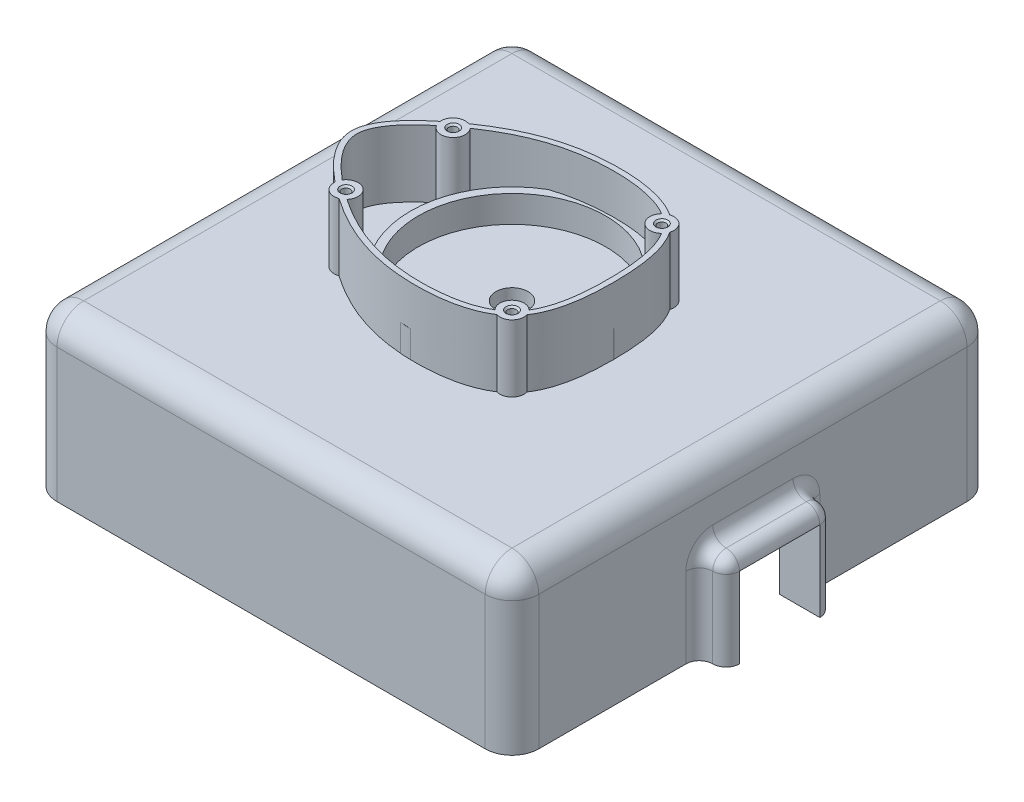
from build123d import *

# Parameters (mm, degrees)
SKETCH1_W                              = 180
SKETCH1_H                              = 180
SKETCH1_R                              = 6
BOSS_EXTRUDE1_DEPTH                    = 60
SHELL1_T                               = -5
FILLET1_R                              = 10
FILLET2_R                              = 10
FILLET3_R                              = 10
SKETCH3_W                              = 20
SKETCH3_H                              = 5
CUT_EXTRUDE2_DEPTH                     = 7
BOSS_EXTRUDE2_DEPTH                    = 10
FILLET4_R                              = 5
BOSS_EXTRUDE3_DEPTH                    = 25
BOSS_EXTRUDE4_OUTLINE_R                = 35
BOSS_EXTRUDE4_DEPTH                    = 10
F_1_8_0_125_DIAMETER_HOLE1_D           = 3.175
F_1_8_0_125_DIAMETER_HOLE1_CSINK_D     = 4.445
F_1_8_0_125_DIAMETER_HOLE1_CSINK_ANGLE = 90


# Read off the part's stored shape, not the designer's step: Boss-Extrude3, Boss-Extrude4
with BuildPart() as part:
    # Sketch1 → Boss-Extrude1 (new body)
    with BuildSketch(Plane(origin=(0, 0, 0), x_dir=(1, 0, 0), z_dir=(0, 1, 0))):
        Rectangle(SKETCH1_W, SKETCH1_H)
        with Locations(Location((0, 0, 0), (0, 0, 270))):
            Circle(SKETCH1_R, mode=Mode.SUBTRACT)
    extrude(amount=BOSS_EXTRUDE1_DEPTH)

    # Shell1
    shell1_openings = [part.faces().sort_by_distance(p)[0] for p in [
        (0, 0, -87.454415588),
        (0, 30, -6),
    ]]
    offset(amount=SHELL1_T, openings=shell1_openings, kind=Kind.INTERSECTION)

    # Fillet1
    fillet1_edges = [part.edges().sort_by_distance(p)[0] for p in [
        (-85, 27.5, -85),
        (-85, 27.5, 85),
        (85, 27.5, 85),
        (85, 27.5, -85),
        (-90, 30, -90),
        (90, 30, -90),
        (90, 30, 90),
        (-90, 30, 90),
    ]]
    fillet(fillet1_edges, radius=FILLET1_R)

    # Fillet2
    fillet2_edges = [part.edges().sort_by_distance(p)[0] for p in [
        (0, 55, -85),
        (-85, 55, 0),
        (85, 55, 0),
        (0, 55, 85),
        (82.071067812, 55, 82.071067812),
        (82.071067812, 55, -82.071067812),
        (-82.071067812, 55, 82.071067812),
        (-82.071067812, 55, -82.071067812),
    ]]
    fillet(fillet2_edges, radius=FILLET2_R)

    # Fillet3
    fillet3_edges = [part.edges().sort_by_distance(p)[0] for p in [
        (-90, 60, 0),
        (0, 60, -90),
        (0, 60, 90),
        (90, 60, 0),
        (87.071067812, 60, -87.071067812),
        (87.071067812, 60, 87.071067812),
        (-87.071067812, 60, 87.071067812),
        (-87.071067812, 60, -87.071067812),
    ]]
    fillet(fillet3_edges, radius=FILLET3_R)

    # Sketch3 → Cut-Extrude2 (cut)
    with BuildSketch(Plane(origin=(90, 0, 0), x_dir=(0, 0, -1), z_dir=(1, 0, 0))):
        Polygon((-15, 0), (-10, 0), (-10, 5), (10, 5), (10, 0), (15, 0), (15, 30), (-15, 30), align=None)
        with Locations((0, 2.5)):
            Rectangle(SKETCH3_W, SKETCH3_H)
    extrude(amount=-CUT_EXTRUDE2_DEPTH, mode=Mode.SUBTRACT)

    # Sketch3<3> → Boss-Extrude2 (add)
    with BuildSketch(Plane(origin=(90, 0, 0), x_dir=(0, 0, -1), z_dir=(1, 0, 0))):
        Polygon((-20, 0), (-15, 0), (-15, 30), (15, 30), (15, 0), (20, 0), (20, 35), (-20, 35), align=None)
    extrude(amount=BOSS_EXTRUDE2_DEPTH)

    # Fillet4
    fillet4_edges = [part.edges().sort_by_distance(p)[0] for p in [
        (100, 17.5, -20),
        (100, 35, 0),
        (95, 35, -20),
        (100, 17.5, 20),
        (95, 35, 20),
        (90, 17.5, -20),
        (90, 17.5, 20),
        (90, 35, 0),
    ]]
    fillet(fillet4_edges, radius=FILLET4_R - 0.0001)  # a hair under: the kernel refuses the full size

    # Boss-Extrude3 outline → Boss-Extrude3 (add)
    with BuildSketch(Plane(origin=(0, 60, 0), x_dir=(1, 0, 0), z_dir=(0, 1, 0))):
        with BuildLine():
            add(Edge.make_bspline(
                [(26.625087679, -32.284812261), (19.606901749, -36.911394991), (-7.262514584, -40.404404335), (-27.710750447, -33.072321099), (-40.409877501, -24.20969244)],
                knots=[0.629826975, 0.629826975, 0.629826975, 0.629826975, 0.72774654, 0.885945732, 0.885945732, 0.885945732, 0.885945732], degree=3))
            ThreePointArc((26.625087679, -32.284812261), (31.152069654, -31.211612819), (32.309789146, -26.705504917))
            add(Edge.make_bspline(
                [(32.297215607, 26.664358571), (36.884317589, 19.814857456), (39.082762224, -0.044680784), (36.950417692, -19.872519787), (32.309789146, -26.705504917)],
                knots=[0.402262299, 0.402262299, 0.402262299, 0.402262299, 0.499984825, 0.598070041, 0.598070041, 0.598070041, 0.598070041], degree=3))
            ThreePointArc((32.297215607, 26.664358571), (31.175671551, 31.188276996), (26.647345626, 32.291890742))
            add(Edge.make_bspline(
                [(-40.409671434, 24.209614596), (-27.70735639, 33.064564243), (-7.232507398, 40.372067868), (19.652233436, 36.956755308), (26.647345626, 32.291890742)],
                knots=[0.114060251, 0.114060251, 0.114060251, 0.114060251, 0.272257083, 0.370446708, 0.370446708, 0.370446708, 0.370446708], degree=3))
            ThreePointArc((-40.409671434, 24.209614596), (-44.702487521, 23.598133016), (-46.486036647, 19.645775214))
            add(Edge.make_bspline(
                [(-46.485781403, -19.642557416), (-53.564421026, -13.907259329), (-59.999057611, -6.954295679), (-60, 0), (-60.000942497, 6.955092679), (-53.566716042, 13.911517693), (-46.486036647, 19.645775214)],
                knots=[0.91116489, 0.91116489, 0.91116489, 0.91116489, 1, 1, 1, 1.088845291, 1.088845291, 1.088845291, 1.088845291], degree=3))
            ThreePointArc((-46.485781403, -19.642557416), (-44.703865881, -23.597097343), (-40.409877501, -24.20969244))
        make_face()
        with BuildLine():
            ThreePointArc((-38.64500615, -22.999002545), (-39.29564632, -16.403269377), (-45.812667803, -17.609693696))
            add(Edge.make_bspline(
                [(-45.812667803, -17.609693696), (-46.115046799, -17.360348632), (-47.948218942, -15.827577283), (-50.841308277, -13.174146607), (-54.009926561, -9.600423532), (-56.255647965, -6.298695596), (-57.673915609, -3.05363463), (-57.999862461, -1.017722031), (-58.000000018, 0.000271024), (-58.000137576, 1.018264078), (-57.674740954, 3.054323695), (-56.257293398, 6.299799005), (-54.012301594, 9.60195316), (-50.843851831, 13.176394975), (-47.95035772, 15.830060836), (-46.116573429, 17.362829378), (-45.814173198, 17.612096565)],
                knots=[0.913678912, 0.913678912, 0.913678912, 0.913678912, 0.917585162, 0.9375, 0.953125, 0.96875, 0.984375, 1, 1, 1, 1.015625, 1.03125, 1.046875, 1.0625, 1.082421395, 1.086327645, 1.086327645, 1.086327645, 1.086327645], degree=3))
            ThreePointArc((-45.814173198, 17.612096565), (-39.297019249, 16.402237492), (-38.64460667, 22.998555586))
            add(Edge.make_bspline(
                [(-38.64460667, 22.998555586), (-38.337281602, 23.209325671), (-37.683999882, 23.651904537), (-34.576067651, 25.701713376), (-29.32151634, 28.755915252), (-21.857658678, 32.043445402), (-14.159900454, 34.366203315), (-7.434846535, 35.515082905), (-1.805560602, 35.965690023), (4.029505715, 36.110632702), (11.50742956, 35.6529722), (18.773990839, 34.012881858), (22.919454497, 32.195832803), (24.495136508, 31.283455718), (24.759890988, 31.122770179)],
                knots=[0.116691957, 0.116691957, 0.116691957, 0.116691957, 0.120598207, 0.125, 0.15625, 0.1875, 0.21875, 0.25, 0.265625, 0.28125, 0.3125, 0.34375, 0.362636405, 0.366542655, 0.366542655, 0.366542655, 0.366542655], degree=3))
            ThreePointArc((24.759890988, 31.122770179), (24.823288671, 24.812759009), (31.133475084, 24.77024244))
            add(Edge.make_bspline(
                [(31.133475084, 24.77024244), (31.290838886, 24.510910775), (32.512945356, 22.397426681), (34.388000271, 17.546305113), (35.764874528, 9.326831938), (36.109066554, -0.009305202), (35.798930663, -9.339298478), (34.441216242, -17.569019377), (32.559136431, -22.421658827), (31.319810475, -24.540281451), (31.161648224, -24.797816291)],
                knots=[0.406263706, 0.406263706, 0.406263706, 0.406263706, 0.410169956, 0.4375, 0.46875, 0.5, 0.53125, 0.5625, 0.590118478, 0.594024728, 0.594024728, 0.594024728, 0.594024728], degree=3))
            ThreePointArc((31.161648224, -24.797816291), (24.845499359, -24.790774905), (24.743917097, -31.106110772))
            add(Edge.make_bspline(
                [(24.743917097, -31.106110772), (24.477300234, -31.266296879), (22.908933163, -32.165777266), (18.76582431, -33.97565501), (11.513353453, -35.627402133), (2.519370888, -36.195161997), (-6.104964822, -35.752033707), (-14.159804158, -34.382342999), (-21.860149477, -32.057286595), (-29.321334927, -28.765154097), (-34.575732278, -25.706124325), (-37.683811979, -23.653554462), (-38.337742307, -23.209983989), (-38.64500615, -22.999002545)],
                knots=[0.633715127, 0.633715127, 0.633715127, 0.633715127, 0.637621377, 0.65625, 0.6875, 0.71875, 0.75, 0.78125, 0.8125, 0.84375, 0.875, 0.879411719, 0.883317969, 0.883317969, 0.883317969, 0.883317969], degree=3))
        make_face(mode=Mode.SUBTRACT)
    extrude(amount=BOSS_EXTRUDE3_DEPTH)

    # Boss-Extrude4 outline → Boss-Extrude4 (add)
    # profile 1 of 3: a face of its own
    with BuildSketch(Plane(origin=(0, 60, 0), x_dir=(1, 0, 0), z_dir=(0, 1, 0))):
        with BuildLine():
            ThreePointArc((15.707724196, -34.601551997), (19.911347804, -32.365695244), (23.802381082, -29.621726061))
            ThreePointArc((23.802381082, -29.621726061), (24.818019484, -24.818019484), (29.621726061, -23.802381082))
            ThreePointArc((29.621726061, -23.802381082), (32.390776864, -19.870520228), (34.641055457, -15.620412186))
            add(Edge.make_bspline(
                [(34.540975495, 15.840486477), (35.015941537, 13.734565824), (35.791044778, 8.61696934), (36.109066554, -0.009305202), (35.825277238, -8.546699585), (35.085356585, -13.583944599), (34.641055457, -15.620412186)],
                knots=[0.444628175, 0.444628175, 0.444628175, 0.444628175, 0.46875, 0.5, 0.53125, 0.554535777, 0.554535777, 0.554535777, 0.554535777], degree=3))
            ThreePointArc((34.540975495, 15.840486477), (32.327403378, 19.973457158), (29.621726061, 23.802381082))
            ThreePointArc((29.621726061, 23.802381082), (24.818019484, 24.818019485), (23.802381082, 29.621726061))
            ThreePointArc((23.802381082, 29.621726061), (19.842112988, 32.4081865), (15.559642986, 34.668393533))
            add(Edge.make_bspline(
                [(-19.212416833, 32.785408941), (-17.53005361, 33.328698452), (-13.240256699, 34.52331134), (-7.434846535, 35.515082905), (-1.805560602, 35.965690023), (4.029505715, 36.110632702), (9.97934878, 35.746493107), (14.210720782, 34.978620526), (15.559642986, 34.668393533)],
                knots=[0.198183508, 0.198183508, 0.198183508, 0.198183508, 0.21875, 0.25, 0.265625, 0.28125, 0.3125, 0.327785501, 0.327785501, 0.327785501, 0.327785501], degree=3))
            ThreePointArc((-19.212416833, 32.785408941), (-37.999985705, -0.032960698), (-19.155512684, -32.818688789))
            add(Edge.make_bspline(
                [(15.707724196, -34.601551997), (14.313724874, -34.929321183), (10.031398179, -35.720952984), (2.519370888, -36.195161997), (-6.104964822, -35.752033707), (-13.221460188, -34.541904346), (-17.492056692, -33.354569832), (-19.155512684, -32.818688789)],
                knots=[0.671697362, 0.671697362, 0.671697362, 0.671697362, 0.6875, 0.71875, 0.75, 0.78125, 0.801578647, 0.801578647, 0.801578647, 0.801578647], degree=3))
        make_face()
        Circle(BOSS_EXTRUDE4_OUTLINE_R, mode=Mode.SUBTRACT)
    # profile 2 of 3: a face of its own
    with BuildSketch(Plane(origin=(0, 60, 0), x_dir=(1, 0, 0), z_dir=(0, 1, 0))):
        with BuildLine():
            ThreePointArc((-3.851345733, -37.804326949), (-1.928156626, -37.95105021), (0, -38))
            add(Edge.make_bspline(
                [(0, -38), (-1.301489692, -37.965581585), (-2.584731945, -37.900400879), (-3.851345733, -37.804326949)],
                knots=[0.72774654, 0.72774654, 0.72774654, 0.72774654, 0.741399754, 0.741399754, 0.741399754, 0.741399754], degree=3))
        make_face()
    # profile 3 of 3: a face of its own
    with BuildSketch(Plane(origin=(0, 60, 0), x_dir=(1, 0, 0), z_dir=(0, 1, 0))):
        with BuildLine():
            ThreePointArc((0, 38), (-2.048031807, 37.944769939), (-4.090110302, 37.779240301))
            add(Edge.make_bspline(
                [(-4.090110302, 37.779240301), (-2.745998065, 37.88734078), (-1.383274309, 37.960859432), (0, 38)],
                knots=[0.257739929, 0.257739929, 0.257739929, 0.257739929, 0.272257083, 0.272257083, 0.272257083, 0.272257083], degree=3))
        make_face()
    extrude(amount=BOSS_EXTRUDE4_DEPTH)

    # 1/8 (0.125) Diameter Hole1 (through all)
    with Locations(Plane(origin=(0, 85, 0), x_dir=(1, 0, 0), z_dir=(0, 1, 0))):
        with Locations((-42, 20), (28, 28), (28, -28), (-42, -20)):
            CounterSinkHole(F_1_8_0_125_DIAMETER_HOLE1_D / 2, F_1_8_0_125_DIAMETER_HOLE1_CSINK_D / 2, counter_sink_angle=F_1_8_0_125_DIAMETER_HOLE1_CSINK_ANGLE)


solid = part.part
